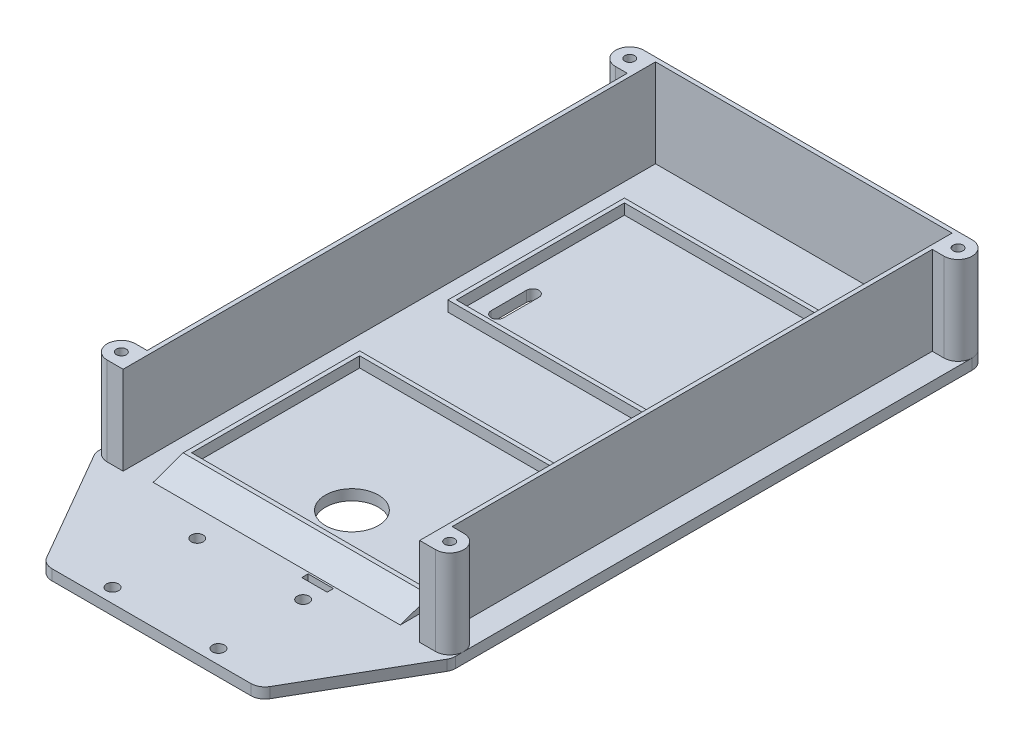
from build123d import *

# Parameters (mm, degrees)
SCHIZZO1_W                    = 101
SCHIZZO1_H                    = 186
ESTRUSIONE_ESTRUSIONE1_DEPTH  = 3
ESTRUSIONE_ESTRUSIONE3_DEPTH  = 25
SCHIZZO2_W                    = 70
SCHIZZO2_H                    = 50
SCHIZZO2_W_2                  = 67.6
SCHIZZO2_H_2                  = 47.6
ESTRUSIONE_ESTRUSIONE2_DEPTH  = 3
ESTRUSIONE_ESTRUSIONE5_DEPTH  = 70
TAGLIO_ESTRUSIONE2_DEPTH      = 109.739367296
TAGLIO_ESTRUSIONE2_DEPTH_BACK = 109.739367296
SCHIZZO9_R                    = 7.5
SCHIZZO4_W                    = 7.2
SCHIZZO4_H                    = 1.8
TAGLIO_ESTRUSIONE1_DEPTH      = 109.739367296
ESTRUSIONE_ESTRUSIONE4_DEPTH  = 25
FORO_2_8_2_8_1_D              = 2.8
FORO_2_8_2_8_1_DEPTH          = 10
FORO_2_8_2_8_1_TIP            = 0.841204867
SMUSSO1_SIZE                  = 20
SMUSSO1_SIZE2                 = 34.641016151
RACCORDO1_R                   = 4
TAGLIO_ESTRUSIONE3_DEPTH      = 109.739367296
FORO_PER_VITE_M3_1_D          = 3.4
FORO_PER_VITE_M3_1_DEPTH      = 10
FORO_PER_VITE_M3_1_TIP        = 1.021463052


with BuildPart() as part:
    # Schizzo1 → Estrusione-Estrusione1 (new body)
    with BuildSketch(Plane(origin=(0, 0, 0), x_dir=(1, 0, 0), z_dir=(0, 1, 0))):
        Rectangle(SCHIZZO1_W, SCHIZZO1_H)
    extrude(amount=ESTRUSIONE_ESTRUSIONE1_DEPTH)

    # Schizzo3 → Estrusione-Estrusione3 (add)
    with BuildSketch(Plane(origin=(0, 3, 0), x_dir=(1, 0, 0), z_dir=(0, 1, 0))):
        Polygon((-43.2, -59), (-42, -59), (-42, 91.8), (42, 91.8), (42, -59), (43.2, -59), (43.2, 93), (-43.2, 93), align=None)
    extrude(amount=ESTRUSIONE_ESTRUSIONE3_DEPTH)

    # Schizzo2 → Estrusione-Estrusione2 (add)
    # profile 1 of 2: a face of its own
    with BuildSketch(Plane(origin=(0, 3, 0), x_dir=(1, 0, 0), z_dir=(0, 1, 0))):
        with Locations((0, 51)):
            Rectangle(SCHIZZO2_W, SCHIZZO2_H)
        with Locations((0, 51)):
            Rectangle(SCHIZZO2_W_2, SCHIZZO2_H_2, mode=Mode.SUBTRACT)
    # profile 2 of 2: a face of its own
    with BuildSketch(Plane(origin=(0, 3, 0), x_dir=(1, 0, 0), z_dir=(0, 1, 0))):
        with Locations((0, -24)):
            Rectangle(SCHIZZO2_W, SCHIZZO2_H)
        with Locations((0, -24)):
            Rectangle(SCHIZZO2_W_2, SCHIZZO2_H_2, mode=Mode.SUBTRACT)
    extrude(amount=ESTRUSIONE_ESTRUSIONE2_DEPTH)

    # Schizzo13 → Estrusione-Estrusione5 (add)
    with BuildSketch(Plane.ZY.offset(35)):
        Polygon((49, 6), (57.5, 3), (49, 3), align=None)
    extrude(amount=-ESTRUSIONE_ESTRUSIONE5_DEPTH)

    # Schizzo9 → Taglio-Estrusione2 (cut, two sides: drawn at the far end of the back side and taken through both)
    with BuildSketch(Plane(origin=(0, 3, 0), x_dir=(1, 0, 0), z_dir=(0, 1, 0)).offset(-TAGLIO_ESTRUSIONE2_DEPTH_BACK)):
        with Locations(Location((0, -36.2, 0), (0, 0, 270))):
            Circle(SCHIZZO9_R)
    extrude(amount=TAGLIO_ESTRUSIONE2_DEPTH + TAGLIO_ESTRUSIONE2_DEPTH_BACK, mode=Mode.SUBTRACT)

    # Schizzo4 → Taglio-Estrusione1 (cut, through all)
    with BuildSketch(Plane(origin=(0, 3, 0), x_dir=(1, 0, 0), z_dir=(0, 1, 0))):
        with Locations((13, -58.9)):
            Rectangle(SCHIZZO4_W, SCHIZZO4_H)
    extrude(amount=-TAGLIO_ESTRUSIONE1_DEPTH, mode=Mode.SUBTRACT)

    # Schizzo5 → Estrusione-Estrusione4 (add)
    with BuildSketch(Plane(origin=(0, 3, 0), x_dir=(1, 0, 0), z_dir=(0, 1, 0))):
        with BuildLine():
            Line((-43.2, 93), (-43.2, 85))
            Line((-43.2, 85), (-46.5, 85))
            ThreePointArc((-46.5, 85), (-50.5, 89), (-46.5, 93))
            Line((-46.5, 93), (-43.2, 93))
        make_face()
        with BuildLine():
            Line((46.5, 85), (43.2, 85))
            Line((43.2, 85), (43.2, 93))
            Line((43.2, 93), (46.5, 93))
            ThreePointArc((46.5, 93), (50.5, 89), (46.5, 85))
        make_face()
        with BuildLine():
            Line((46.5, -51), (43.2, -51))
            Line((43.2, -51), (43.2, -59))
            Line((43.2, -59), (46.5, -59))
            ThreePointArc((46.5, -59), (50.5, -55), (46.5, -51))
        make_face()
        with BuildLine():
            Line((-46.5, -51), (-43.2, -51))
            Line((-43.2, -51), (-43.2, -59))
            Line((-43.2, -59), (-46.5, -59))
            ThreePointArc((-46.5, -59), (-50.5, -55), (-46.5, -51))
        make_face()
    extrude(amount=ESTRUSIONE_ESTRUSIONE4_DEPTH)

    # Foro Ø2.8 (2.8)-1
    with Locations(Plane(origin=(0, 28, 0), x_dir=(1, 0, 0), z_dir=(0, 1, 0))):
        with Locations((-46.5, 89), (46.5, 89), (46.5, -55), (-46.5, -55)):
            Hole(FORO_2_8_2_8_1_D / 2, depth=FORO_2_8_2_8_1_DEPTH)
            with Locations((0, 0, -(FORO_2_8_2_8_1_DEPTH + FORO_2_8_2_8_1_TIP / 2))):  # 118° drill point
                Cone(0, FORO_2_8_2_8_1_D / 2, FORO_2_8_2_8_1_TIP, mode=Mode.SUBTRACT)

    # Smusso1
    smusso1_edges = [part.edges().sort_by_distance(p)[0] for p in [
        (50.5, 1.5, 93),
        (-50.5, 1.5, 93),
    ]]
    smusso1_side = [part.faces().sort_by_distance(p)[0] for p in [
        (0, 1.5, 93),
    ]]
    chamfer(smusso1_edges, length=SMUSSO1_SIZE, length2=SMUSSO1_SIZE2, reference=smusso1_side[0])

    # Raccordo1
    raccordo1_edges = [part.edges().sort_by_distance(p)[0] for p in [
        (50.5, 1.5, 58.358983849),
        (-50.5, 1.5, 58.358983849),
        (30.5, 1.5, 93),
        (-30.5, 1.5, 93),
        (-50.5, 1.5, -93),
        (50.5, 1.5, -93),
    ]]
    fillet(raccordo1_edges, radius=RACCORDO1_R - 0.0001)  # a hair under: the kernel refuses the full size

    # Schizzo10 → Taglio-Estrusione3 (cut, through all)
    with BuildSketch(Plane(origin=(0, 3, 0), x_dir=(1, 0, 0), z_dir=(0, 1, 0))):
        with BuildLine():
            Line((29.25, 42.5), (29.25, 32.5))
            ThreePointArc((29.25, 32.5), (27.5, 30.75), (25.75, 32.5))
            Line((25.75, 32.5), (25.75, 42.5))
            ThreePointArc((25.75, 42.5), (27.5, 44.25), (29.25, 42.5))
        make_face()
        with BuildLine():
            Line((-25.75, 42.5), (-25.75, 32.5))
            ThreePointArc((-25.75, 32.5), (-27.5, 30.75), (-29.25, 32.5))
            Line((-29.25, 32.5), (-29.25, 42.5))
            ThreePointArc((-29.25, 42.5), (-27.5, 44.25), (-25.75, 42.5))
        make_face()
    extrude(amount=-TAGLIO_ESTRUSIONE3_DEPTH, mode=Mode.SUBTRACT)

    # Foro per Vite M3-1
    with Locations(Plane(origin=(0, 3, 0), x_dir=(1, 0, 0), z_dir=(0, 1, 0))):
        with Locations((15, -65), (15, -89), (-15, -89), (-15, -65)):
            Hole(FORO_PER_VITE_M3_1_D / 2, depth=FORO_PER_VITE_M3_1_DEPTH)
            with Locations((0, 0, -(FORO_PER_VITE_M3_1_DEPTH + FORO_PER_VITE_M3_1_TIP / 2))):  # 118° drill point
                Cone(0, FORO_PER_VITE_M3_1_D / 2, FORO_PER_VITE_M3_1_TIP, mode=Mode.SUBTRACT)


solid = part.part
